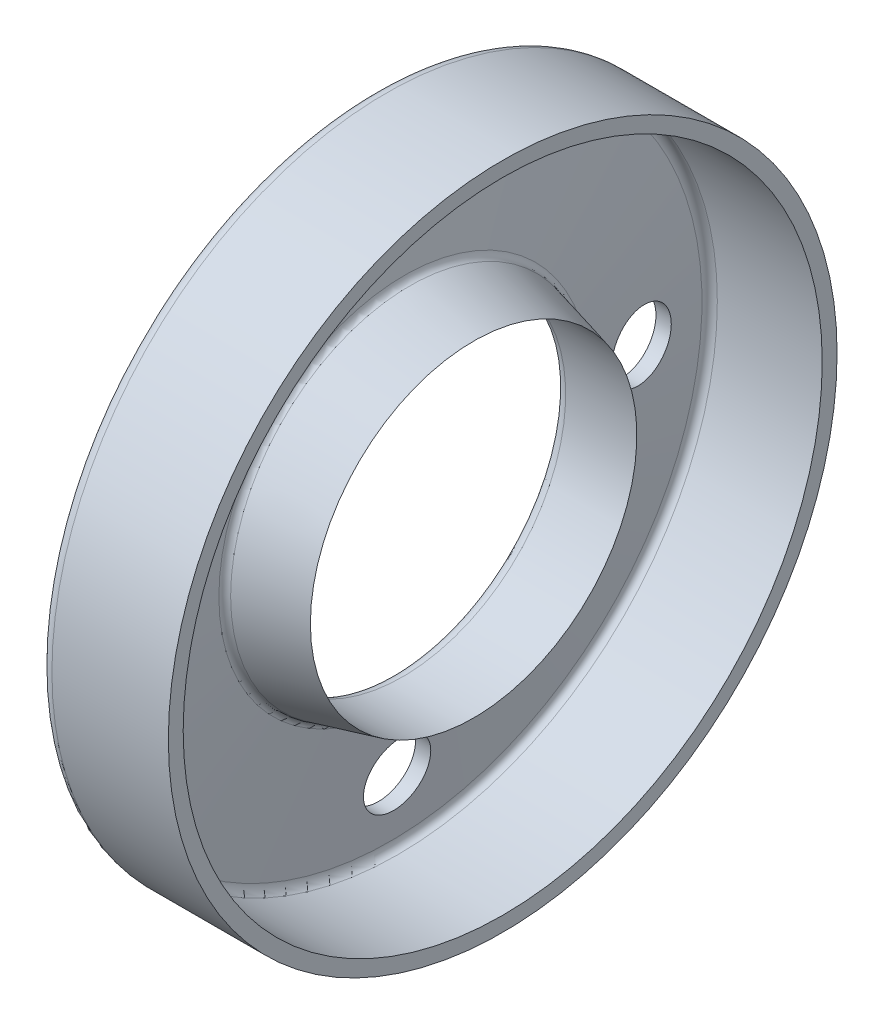
from build123d import *

# Parameters (mm, degrees)
SKETCH2_R          = 3.4925
CUT_EXTRUDE1_DEPTH = 52.167986429


with BuildPart() as part:
    # Sketch1 → Revolve1 (revolve)
    with BuildSketch(Plane.XY):
        with BuildLine():
            Line((0.155348807, 33.477735982), (1.843834582, 18.161535982))
            ThreePointArc((1.843834582, 18.161535982), (2.258790389, 17.35475119), (3.106186901, 17.0307))
            Line((3.106186901, 17.0307), (10.5283, 17.0307))
            Line((10.5283, 17.0307), (3.88013628, 18.704834032))
            ThreePointArc((3.88013628, 18.704834032), (3.491808651, 18.943062367), (3.308801824, 19.360266859))
            Line((3.308801824, 19.360266859), (1.861135478, 32.492001589))
            ThreePointArc((1.861135478, 32.492001589), (2.050977583, 33.083937907), (2.618546869, 33.3375))
            Line((2.618546869, 33.3375), (13.5636, 33.3375))
            Line((13.5636, 33.3375), (13.5636, 34.8869))
            Line((13.5636, 34.8869), (1.417701126, 34.8869))
            ThreePointArc((1.417701126, 34.8869), (0.471752315, 34.464296512), (0.155348807, 33.477735982))
        make_face()
    revolve(axis=Axis((-1000.538686221, 0, 0), (1, 0, 0)))

    # Sketch2 → Cut-Extrude1 (cut, through all)
    with BuildSketch(Plane(origin=(0, 0, 0), x_dir=(0, 0, -1), z_dir=(1, 0, 0))):
        with Locations((0, -26.0604)):
            Circle(SKETCH2_R)
        with Locations((0, 26.0604)):
            Circle(SKETCH2_R)
        with Locations((25.4, 0)):
            Circle(SKETCH2_R)
    extrude(amount=CUT_EXTRUDE1_DEPTH, mode=Mode.SUBTRACT)


solid = part.part
